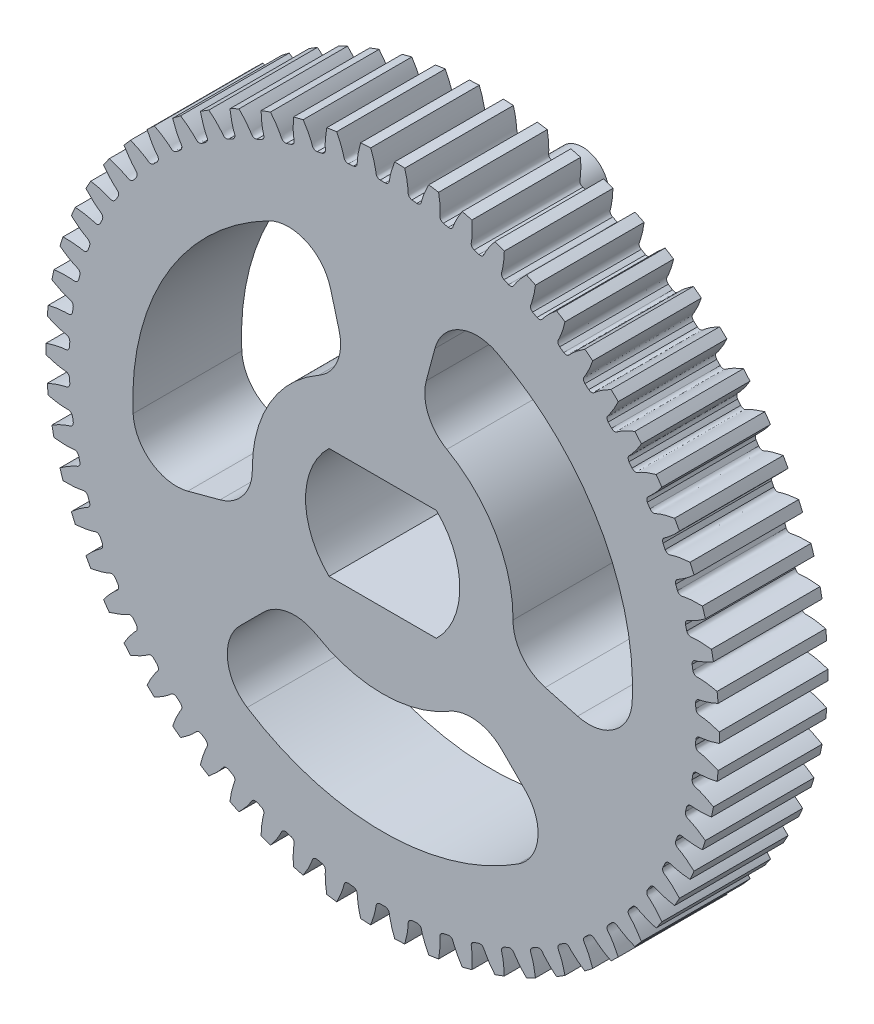
from build123d import *
from build123d.topology import SkipClean

# Parameters (mm, degrees)
SKETCH_1_R                       = 15.4962
EXTRUDE_1_DEPTH                  = 5
CUT_EXTRUDE_1_DEPTH              = 23.47808775
PATTERN_CIRCULAR_1_COUNT         = 62
SKETCH_6_R                       = 1.2
EXTRUDE_2_DEPTH                  = 4.2
SKETCH_8_R                       = 6
EXTRUDE_3_DEPTH                  = 0.8
PATTERN_CIRCULAR_4_COUNT         = 3
CUT_EXTRUDE_5_DEPTH              = 13
CUT_EXTRUDE_START                = -10
CUT_EXTRUDE_6_DEPTH              = 10
FILLET_1_R                       = 2
PATTERN_CIRCULAR_5_COUNT         = 3
FILLET_1_OF_PATTERN_CIRCULAR_5_R = 2
SKETCH_11_R                      = 2
SKETCH_11_R_2                    = 2.25
EXTRUDE_5_DEPTH                  = 1


with BuildPart() as part:
    # 草图1 → 凸台-拉伸1 (new body)
    with BuildSketch(Plane.XY):
        Circle(SKETCH_1_R)
    extrude(amount=EXTRUDE_1_DEPTH)

    # 草图2 → 切除-拉伸1 (cut, through all)
    with BuildSketch(Plane.XY):
        with BuildLine():
            ThreePointArc((0.115149047, 14.42524042), (0, 14.4257), (-0.115149047, 14.42524042))
            add(Edge.make_bspline(
                [(-0.115149047, 14.42524042), (-0.300465112, 14.454703793), (-0.301884189, 14.577972184), (-0.323102145, 14.712045928), (-0.330832235, 14.755984263), (-0.340597147, 14.805462456), (-0.352576754, 14.860433217), (-0.367008292, 14.920819477), (-0.384108183, 14.986544767), (-0.404096524, 15.057523678), (-0.427189237, 15.133664903), (-0.453600243, 15.214870384), (-0.483540578, 15.301035651), (-0.517218429, 15.392049817), (-0.554838903, 15.487795672), (-0.596603875, 15.588149756), (-0.642711813, 15.692982445), (-0.693357618, 15.802158039), (-0.748732455, 15.915534855), (-0.809023599, 16.032965316), (-0.874414267, 16.15429606), (-0.945083473, 16.279368039), (-1.021205864, 16.408016627), (-1.102951576, 16.540071731), (-1.190486081, 16.675357911), (-1.283970045, 16.813694493), (-1.383559192, 16.954895696), (-1.489404108, 17.098770759), (-1.641429634, 17.296990643), (-1.761783956, 17.444394524), (-1.84514899, 17.542549995)],
                knots=[0, 0, 0, 0, 0.089701035, 0.100437027, 0.112785958, 0.126747829, 0.14232264, 0.15951039, 0.17831108, 0.19872471, 0.220751279, 0.244390788, 0.269643237, 0.296508625, 0.324986953, 0.355078221, 0.386782429, 0.420099576, 0.455029662, 0.491572689, 0.529728655, 0.569497561, 0.610879407, 0.653874192, 0.698481917, 0.744702581, 0.792536186, 0.84198273, 0.893042214, 1, 1, 1, 1], degree=3))
            ThreePointArc((-1.84514899, 17.542549995), (0, 17.63932071), (1.84514899, 17.542549995))
            add(Edge.make_bspline(
                [(0.115149047, 14.42524042), (0.300465112, 14.454703793), (0.301884189, 14.577972184), (0.323102145, 14.712045928), (0.330832235, 14.755984263), (0.340597147, 14.805462456), (0.352576754, 14.860433217), (0.367008292, 14.920819477), (0.384108183, 14.986544767), (0.404096524, 15.057523678), (0.427189237, 15.133664903), (0.453600243, 15.214870384), (0.483540578, 15.301035651), (0.517218429, 15.392049817), (0.554838903, 15.487795672), (0.596603875, 15.588149756), (0.642711813, 15.692982445), (0.693357618, 15.802158039), (0.748732455, 15.915534855), (0.809023599, 16.032965316), (0.874414267, 16.15429606), (0.945083473, 16.279368039), (1.021205864, 16.408016627), (1.102951576, 16.540071731), (1.190486081, 16.675357911), (1.283970045, 16.813694493), (1.383559192, 16.954895696), (1.489404108, 17.098770759), (1.641429634, 17.296990643), (1.761783956, 17.444394524), (1.84514899, 17.542549995)],
                knots=[0, 0, 0, 0, 0.089701035, 0.100437027, 0.112785958, 0.126747829, 0.14232264, 0.15951039, 0.17831108, 0.19872471, 0.220751279, 0.244390788, 0.269643237, 0.296508625, 0.324986953, 0.355078221, 0.386782429, 0.420099576, 0.455029662, 0.491572689, 0.529728655, 0.569497561, 0.610879407, 0.653874192, 0.698481917, 0.744702581, 0.792536186, 0.84198273, 0.893042214, 1, 1, 1, 1], degree=3))
        make_face()
    cut_extrude_1 = extrude(amount=CUT_EXTRUDE_1_DEPTH, mode=Mode.SUBTRACT)

    # 阵列(圆周)1: 切除-拉伸1 ×62 about axis
    pattern_circular_1_axis = Axis((0, 0, 5), (0, 0, -1))
    for i in range(1, PATTERN_CIRCULAR_1_COUNT):
        add(cut_extrude_1.rotate(pattern_circular_1_axis, i * 360 / PATTERN_CIRCULAR_1_COUNT), mode=Mode.SUBTRACT)

    # 草图6 → 凸台-拉伸2 (add)
    with BuildSketch(Plane(origin=(0, 0, 0), x_dir=(-1, 0, 0), z_dir=(0, 0, -1))):
        with Locations((0, 10)):
            Circle(SKETCH_6_R)
    extrude_2 = extrude(amount=EXTRUDE_2_DEPTH)

    # 草图8 → 凸台-拉伸3 (add)
    with BuildSketch(Plane(origin=(0, 0, 0), x_dir=(-1, 0, 0), z_dir=(0, 0, -1))):
        Circle(SKETCH_8_R)
    extrude(amount=EXTRUDE_3_DEPTH)

    # 阵列(圆周)4: 凸台-拉伸2 ×3 about axis
    pattern_circular_4_axis = Axis((0, 0, -0.8), (0, 0, 1))
    for i in range(1, PATTERN_CIRCULAR_4_COUNT):
        add(extrude_2.rotate(pattern_circular_4_axis, i * 360 / PATTERN_CIRCULAR_4_COUNT))

    # 草图9 → 切除-拉伸5 (cut)
    with BuildSketch(Plane(origin=(0, 0, -0.8), x_dir=(-1, 0, 0), z_dir=(0, 0, -1))):
        with BuildLine():
            Line((2.469817807, 2.55), (-2.469817807, 2.55))
            ThreePointArc((-2.469817807, 2.55), (-3.55, 0), (-2.469817807, -2.55))
            Line((-2.469817807, -2.55), (2.469817807, -2.55))
            ThreePointArc((2.469817807, -2.55), (3.26881884, -1.384674472), (3.55, 0))
            ThreePointArc((3.55, 0), (3.26881884, 1.384674472), (2.469817807, 2.55))
        make_face()
    extrude(amount=-CUT_EXTRUDE_5_DEPTH, mode=Mode.SUBTRACT)

    # 草图10 → 切除-拉伸6 (cut)
    with BuildSketch(Plane(origin=(0, 0, 0), x_dir=(-1, 0, 0), z_dir=(0, 0, -1)).offset(CUT_EXTRUDE_START)):
        with BuildLine():
            Line((-4.242640687, -4.242640687), (-8.131727984, -8.131727984))
            ThreePointArc((-8.131727984, -8.131727984), (0, -11.5), (8.131727984, -8.131727984))
            Line((8.131727984, -8.131727984), (4.242640687, -4.242640687))
            ThreePointArc((4.242640687, -4.242640687), (0, -6), (-4.242640687, -4.242640687))
        make_face()
    cut_extrude_6 = extrude(amount=CUT_EXTRUDE_6_DEPTH, mode=Mode.SUBTRACT)

    # 圆角1
    fillet_1_edges = [part.edges().sort_by_distance(p)[0] for p in [
        (-4.242640687, -4.242640687, 2.5),
        (4.242640687, -4.242640687, 2.5),
        (8.131727984, -8.131727984, 2.5),
        (-8.131727984, -8.131727984, 2.5),
    ]]
    fillet(fillet_1_edges, radius=FILLET_1_R)

    # 阵列(圆周)5: 切除-拉伸6 ×3 about axis
    with SkipClean():  # the faces are left unmerged after this step: merging them gives an invalid solid
        pattern_circular_5_axis = Axis((0, 0, -0.8), (0, 0, 1))
        for i in range(1, PATTERN_CIRCULAR_5_COUNT):
            add(cut_extrude_6.rotate(pattern_circular_5_axis, i * 360 / PATTERN_CIRCULAR_5_COUNT), mode=Mode.SUBTRACT)

    # 圆角1 of 阵列(圆周)5
    fillet_1_of_pattern_circular_5_edges = [part.edges().sort_by_distance(p)[0] for p in [
        (5.795554958, -1.552914271, 2.5),
        (1.552914271, 5.795554958, 2.5),
        (2.976419019, 11.108147002, 2.5),
        (11.108147002, -2.976419019, 2.5),
        (-1.552914271, 5.795554958, 2.5),
        (-5.795554958, -1.552914271, 2.5),
        (-11.108147002, -2.976419019, 2.5),
        (-2.976419019, 11.108147002, 2.5),
    ]]
    fillet(fillet_1_of_pattern_circular_5_edges, radius=FILLET_1_OF_PATTERN_CIRCULAR_5_R)

    # 草图11 → 凸台-拉伸5 (add)
    with BuildSketch(Plane(origin=(0, 0, 0), x_dir=(-1, 0, 0), z_dir=(0, 0, -1))):
        with Locations((-8.660254038, -5)):
            Circle(SKETCH_11_R)
        with Locations((8.660254038, -5)):
            Circle(SKETCH_11_R)
        with Locations((0, 10)):
            Circle(SKETCH_11_R_2)
    extrude(amount=EXTRUDE_5_DEPTH)


solid = part.part
